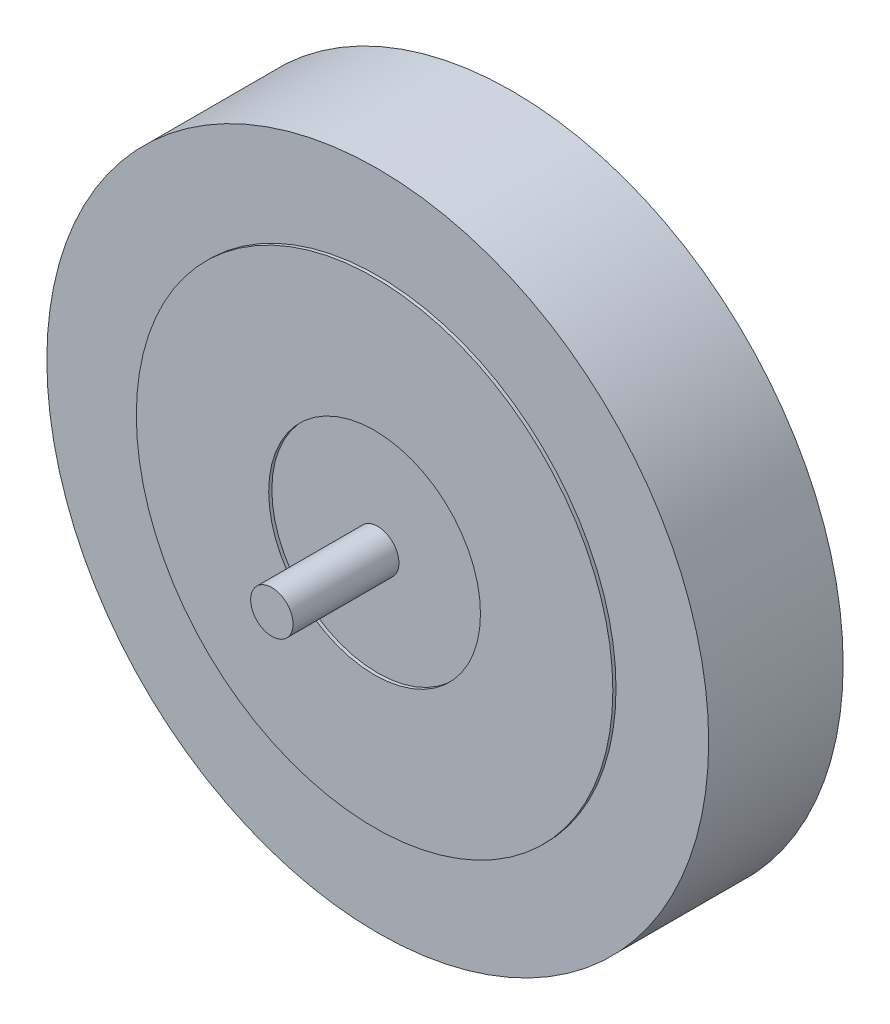
from build123d import *

# Parameters (mm, degrees)
SKETCH1_R                = 62.5
SKETCH1_R_2              = 45
BOSS_EXTRUDE1_DEPTH      = 25.4
SKETCH1_R_3              = 20
SKETCH1_R_4              = 4
BOSS_EXTRUDE1_2_DEPTH    = 25.4
BOSS_EXTRUDE3_DEPTH      = 0.6
BOSS_EXTRUDE3_DEPTH_BACK = 26
SKETCH2_R                = 45
SKETCH2_R_2              = 20
SKETCH3_R                = 4
BOSS_EXTRUDE4_DEPTH      = 20


with BuildPart() as part:
    # Sketch1 → Boss-Extrude1 (new body)
    with BuildSketch(Plane.XY):
        Circle(SKETCH1_R)
        Circle(SKETCH1_R_2, mode=Mode.SUBTRACT)
    extrude(amount=BOSS_EXTRUDE1_DEPTH)



with BuildPart() as body_2:
    # Sketch1 → Boss-Extrude1 2 (new body)
    with BuildSketch(Plane.XY):
        Circle(SKETCH1_R_3)
        Circle(SKETCH1_R_4, mode=Mode.SUBTRACT)
    extrude(amount=BOSS_EXTRUDE1_2_DEPTH)


with BuildPart() as part_1:
    add(part.part)

    add(body_2.part)  # Boss-Extrude3 merges body 2
    # Sketch2 → Boss-Extrude3 (add, two sides: drawn at the far end of the back side and taken through both)
    with BuildSketch(Plane.XY.offset(25.4).offset(-BOSS_EXTRUDE3_DEPTH_BACK)):
        Circle(SKETCH2_R)
        Circle(SKETCH2_R_2, mode=Mode.SUBTRACT)
    extrude(amount=BOSS_EXTRUDE3_DEPTH + BOSS_EXTRUDE3_DEPTH_BACK)


with BuildPart() as body_2_2:
    # Sketch3 → Boss-Extrude4 (new body)
    with BuildSketch(Plane.XY.offset(25.4)):
        Circle(SKETCH3_R)
    extrude(amount=BOSS_EXTRUDE4_DEPTH)


solid = Compound([part_1.part, body_2_2.part])
